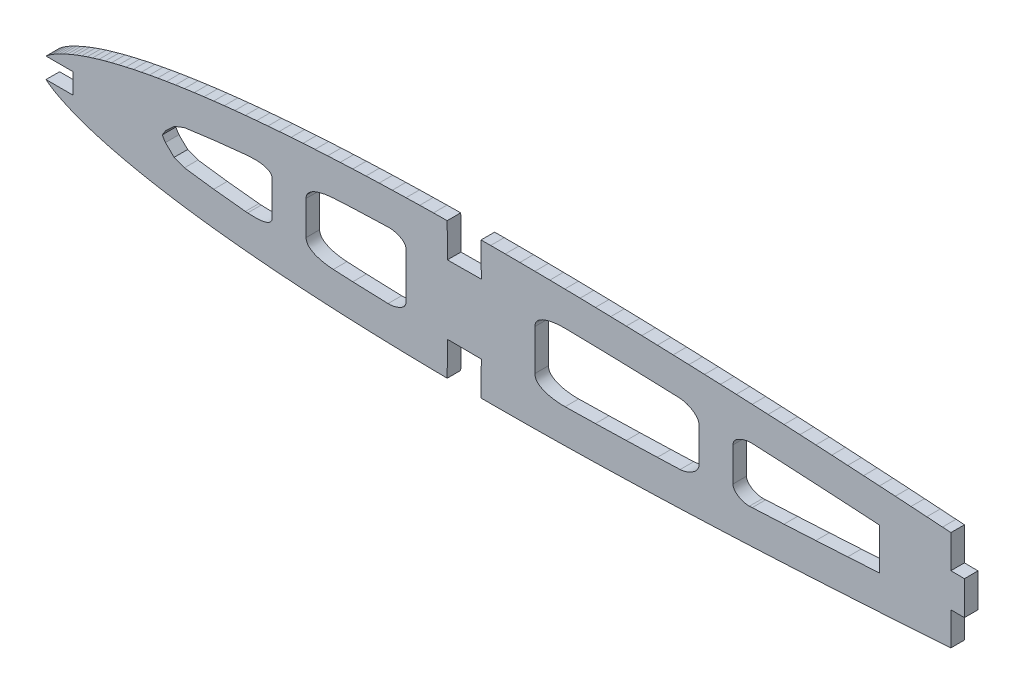
from build123d import *

# Parameters (mm, degrees)
EXTRUDE_1_DEPTH = 2


with BuildPart() as part:
    # Model → 凸台-拉伸1 (new body)
    with BuildSketch(Plane.XY):
        Polygon((21.686734091, -120.90973406), (21.457327195, -121.09873406), (25.449734091, -121.09873406), (25.449734091, -124.09873406), (21.456905913, -124.09873406), (21.686734091, -124.28873406), (22.056734091, -124.55873406), (22.439734091, -124.80873406), (22.941734091, -125.10373406), (23.455734091, -125.37573406), (23.977734091, -125.63073406), (24.626734091, -125.92873406), (25.282734091, -126.20973406), (25.944734091, -126.47473406), (26.734734091, -126.76873406), (27.531734091, -127.04373406), (28.334734091, -127.30173406), (29.264734091, -127.58073406), (30.198734091, -127.84273406), (31.136734091, -128.08973406), (32.200734091, -128.35373406), (33.268734091, -128.60273406), (34.339734091, -128.83773406), (35.533734091, -129.08373406), (36.730734091, -129.31373406), (37.930734091, -129.53173406), (39.249734091, -129.75673406), (40.570734091, -129.96773406), (41.893734091, -130.16673406), (43.333734091, -130.36973406), (44.773734091, -130.55973406), (46.216734091, -130.73773406), (47.770734091, -130.91573406), (49.326734091, -131.08273406), (50.882734091, -131.23773406), (52.544734091, -131.39273406), (54.206734091, -131.53673406), (55.870734091, -131.66973406), (57.633734091, -131.79873406), (59.396734091, -131.91773406), (61.161734091, -132.02673406), (63.018734091, -132.12973406), (64.876734091, -132.22373406), (66.735734091, -132.30673406), (68.679734091, -132.38473406), (70.623734091, -132.45373406), (72.569734091, -132.51373406), (74.592734091, -132.56673406), (76.615734091, -132.61073406), (78.639734091, -132.64573406), (80.670734091, -132.67273406), (80.703734091, -127.67373406), (85.703734091, -127.70573406), (85.670734091, -132.70573406), (87.083734091, -132.70873406), (89.240734091, -132.70473406), (91.399734091, -132.69373406), (93.611734091, -132.67473406), (95.822734091, -132.64773406), (98.034734091, -132.61473406), (100.292734091, -132.57373406), (102.550734091, -132.52573406), (104.807734091, -132.47073406), (107.103734091, -132.40973406), (109.397734091, -132.34273406), (111.692734091, -132.26873406), (114.015734091, -132.18873406), (116.336734091, -132.10273406), (118.658734091, -132.01073406), (121.000734091, -131.91373406), (123.341734091, -131.81073406), (125.683734091, -131.70273406), (128.033734091, -131.58973406), (130.382734091, -131.47073406), (132.732734091, -131.34573406), (135.082734091, -131.21573406), (137.431734091, -131.08173406), (139.781734091, -130.94373406), (142.123734091, -130.80473406), (144.464734091, -130.66373406), (146.806734091, -130.51773406), (149.128734091, -130.36773406), (151.450734091, -130.21273406), (153.772734091, -130.05473406), (155.015715913, -129.96861898), (155.015715913, -125.09813493), (157.015715913, -125.09813493), (157.015715913, -122.59813493), (157.015715913, -120.117743076), (155.015812036, -120.09813493), (155.015812036, -115.2298558), (153.772734091, -115.14373406), (151.450734091, -114.98573406), (149.128734091, -114.83073406), (146.806734091, -114.68073406), (144.464734091, -114.53473406), (142.123734091, -114.39273406), (139.781734091, -114.25473406), (137.431734091, -114.11673406), (135.082734091, -113.98273406), (132.732734091, -113.85273406), (130.382734091, -113.72773406), (128.033734091, -113.60873406), (125.683734091, -113.49573406), (123.341734091, -113.38773406), (121.000734091, -113.28473406), (118.658734091, -113.18773406), (116.336734091, -113.09573406), (114.015734091, -113.00973406), (111.692734091, -112.92973406), (109.397734091, -112.85573406), (107.103734091, -112.78873406), (104.807734091, -112.72773406), (102.550734091, -112.67273406), (100.292734091, -112.62473406), (98.034734091, -112.58373406), (95.822734091, -112.54973406), (93.611734091, -112.52373406), (91.399734091, -112.50473406), (89.240734091, -112.49373406), (87.083734091, -112.48973406), (85.670734091, -112.49273406), (85.705734091, -117.49273406), (80.705734091, -117.52473406), (80.670739865, -112.525558807), (78.639734091, -112.55173406), (76.615734091, -112.58773406), (74.592734091, -112.63173406), (72.569734091, -112.68473406), (70.623734091, -112.74473406), (68.679734091, -112.81273406), (66.735734091, -112.89073406), (64.876734091, -112.97473406), (63.018734091, -113.06873406), (61.161734091, -113.17173406), (59.396734091, -113.28073406), (57.633734091, -113.39873406), (55.870734091, -113.52873406), (54.206734091, -113.66173406), (52.544734091, -113.80573406), (50.882734091, -113.95973406), (49.326734091, -114.11573406), (47.770734091, -114.28173406), (46.216734091, -114.46073406), (44.773734091, -114.63873406), (43.333734091, -114.82873406), (41.893734091, -115.03173406), (40.570734091, -115.23073406), (39.249734091, -115.44173406), (37.930734091, -115.66673406), (36.730734091, -115.88473406), (35.533734091, -116.11473406), (34.339734091, -116.36073406), (33.268734091, -116.59573406), (32.200734091, -116.84473406), (31.136734091, -117.10873406), (30.198734091, -117.35573406), (29.264734091, -117.61773406), (28.334734091, -117.89673406), (27.531734091, -118.15473406), (26.734734091, -118.42873406), (25.944734091, -118.72273406), (25.282734091, -118.98873406), (24.626734091, -119.26973406), (23.977734091, -119.56773406), (23.455734091, -119.82273406), (22.941734091, -120.09473406), (22.439734091, -120.38973406), (22.056734091, -120.63973406), align=None)
        with BuildLine():
            add(Edge.make_bspline(
                [(125.683734091, -118.49573406), (124.599970291, -118.44222625), (122.850528389, -119.013650164), (122.850528389, -120.09873406)],
                knots=[0, 0, 0, 0, 3.255251688, 3.255251688, 3.255251688, 3.255251688], degree=3))
            Line((125.683734091, -118.49573406), (130.382734091, -118.72773406))
            Line((130.382734091, -118.72773406), (135.082734091, -118.98273406))
            Line((135.082734091, -118.98273406), (139.781734091, -119.25473406))
            Line((139.781734091, -119.25473406), (144.464734091, -119.53473406))
            Line((144.464734091, -119.53473406), (144.464734091, -125.66273406))
            Line((144.464734091, -125.66273406), (139.781734091, -125.94273406))
            Line((139.781734091, -125.94273406), (135.082734091, -126.21473406))
            Line((135.082734091, -126.21473406), (130.382734091, -126.46973406))
            Line((130.382734091, -126.46973406), (125.683734091, -126.70173406))
            Line((125.683734091, -126.70173406), (125.277682483, -126.72002936))
            add(Edge.make_bspline(
                [(122.850528389, -125.09873406), (122.850528389, -126.071683496), (124.305719136, -126.763822712), (125.277682483, -126.72002936)],
                knots=[0, 0, 0, 0, 2.918848307, 2.918848307, 2.918848307, 2.918848307], degree=3))
            Line((122.850528389, -125.09873406), (122.850528389, -120.09873406))
        make_face(mode=Mode.SUBTRACT)
        with BuildLine():
            Line((40.372806364, -120.616513555), (41.893734091, -120.03173406))
            Line((41.893734091, -120.03173406), (46.216734091, -119.46073406))
            Line((46.216734091, -119.46073406), (50.882734091, -118.95973406))
            Line((50.882734091, -118.95973406), (51.358530456, -118.918621744))
            add(Edge.make_bspline(
                [(51.358530456, -118.918621744), (52.581056879, -118.812986442), (54.845492165, -118.87165229), (54.845492165, -120.09873406)],
                knots=[0, 0, 0, 0, 3.68124531, 3.68124531, 3.68124531, 3.68124531], degree=3))
            Line((54.845492165, -120.09873406), (54.845492165, -125.09873406))
            add(Edge.make_bspline(
                [(51.215506571, -126.266488057), (52.48185245, -126.375909684), (54.845492165, -126.369798566), (54.845492165, -125.09873406)],
                knots=[0, 0, 0, 0, 3.813193518, 3.813193518, 3.813193518, 3.813193518], degree=3))
            Line((51.215506571, -126.266488057), (50.882734091, -126.23773406))
            Line((50.882734091, -126.23773406), (46.216734091, -125.73673406))
            Line((46.216734091, -125.73673406), (41.893734091, -125.16573406))
            Line((41.893734091, -125.16573406), (40.372806364, -124.580954565))
            Line((40.372806364, -124.580954565), (39.083615037, -123.34527798))
            Line((39.083615037, -123.34527798), (38.614255702, -122.59873406))
            Line((38.614255702, -122.59873406), (39.083615037, -121.85219014))
            Line((39.083615037, -121.85219014), (40.372806364, -120.616513555))
        make_face(mode=Mode.SUBTRACT)
        with BuildLine():
            add(Edge.make_bspline(
                [(63.941669072, -118.031590226), (62.414202655, -118.108593826), (59.845492165, -118.569327898), (59.845492165, -120.09873406)],
                knots=[0, 0, 0, 0, 4.588218487, 4.588218487, 4.588218487, 4.588218487], degree=3))
            Line((63.941669072, -118.031590226), (64.33931484, -118.011543857))
            Line((64.33931484, -118.011543857), (66.735734091, -117.89073406))
            Line((66.735734091, -117.89073406), (71.980504596, -117.705539901))
            add(Edge.make_bspline(
                [(71.980504596, -117.705539901), (72.983361277, -117.670128781), (74.592734091, -118.198399194), (74.592734091, -119.201880868)],
                knots=[0, 0, 0, 0, 3.010445021, 3.010445021, 3.010445021, 3.010445021], degree=3))
            Line((74.592734091, -119.201880868), (74.592734091, -124.309067986))
            Line((74.592734091, -124.309067986), (74.592734091, -125.99563406))
            add(Edge.make_bspline(
                [(71.942427898, -127.490583721), (72.956082865, -127.526376132), (74.592734091, -127.00992075), (74.592734091, -125.99563406)],
                knots=[0, 0, 0, 0, 3.042860071, 3.042860071, 3.042860071, 3.042860071], degree=3))
            Line((71.942427898, -127.490583721), (66.735734091, -127.30673406))
            Line((66.735734091, -127.30673406), (63.866106275, -127.162068575))
            add(Edge.make_bspline(
                [(59.845492165, -125.09873406), (59.845492165, -126.605116303), (62.361634577, -127.086224199), (63.866106275, -127.162068575)],
                knots=[0, 0, 0, 0, 4.519146728, 4.519146728, 4.519146728, 4.519146728], degree=3))
            Line((59.845492165, -125.09873406), (59.845492165, -120.09873406))
        make_face(mode=Mode.SUBTRACT)
        with BuildLine():
            add(Edge.make_bspline(
                [(98.034734091, -117.58373406), (96.41535795, -117.551819871), (93.611734091, -117.975920563), (93.611734091, -119.595611152)],
                knots=[0, 0, 0, 0, 4.859071767, 4.859071767, 4.859071767, 4.859071767], degree=3))
            Line((98.034734091, -117.58373406), (101.176323663, -117.645647584))
            Line((101.176323663, -117.645647584), (103.871414129, -117.706381959))
            Line((103.871414129, -117.706381959), (107.103734091, -117.78873406))
            Line((107.103734091, -117.78873406), (111.692734091, -117.92973406))
            Line((111.692734091, -117.92973406), (114.988595775, -118.047544792))
            add(Edge.make_bspline(
                [(114.988595775, -118.047544792), (116.16154149, -118.089471792), (117.850528389, -118.925039244), (117.850528389, -120.09873406)],
                knots=[0, 0, 0, 0, 3.52108445, 3.52108445, 3.52108445, 3.52108445], degree=3))
            Line((117.850528389, -120.09873406), (117.850528389, -125.09873406))
            add(Edge.make_bspline(
                [(115.053477267, -127.147604136), (116.208467568, -127.106318953), (117.850528389, -126.254461997), (117.850528389, -125.09873406)],
                knots=[0, 0, 0, 0, 3.46718381, 3.46718381, 3.46718381, 3.46718381], degree=3))
            Line((115.053477267, -127.147604136), (111.692734091, -127.26773406))
            Line((111.692734091, -127.26773406), (107.103734091, -127.40873406))
            Line((107.103734091, -127.40873406), (102.550734091, -127.52473406))
            Line((102.550734091, -127.52473406), (98.070159688, -127.613035903))
            add(Edge.make_bspline(
                [(93.611734091, -125.60183406), (93.611734091, -127.232188202), (96.440122063, -127.645160205), (98.070159688, -127.613035903)],
                knots=[0, 0, 0, 0, 4.891062426, 4.891062426, 4.891062426, 4.891062426], degree=3))
            Line((93.611734091, -125.60183406), (93.611734091, -119.595611152))
        make_face(mode=Mode.SUBTRACT)
    extrude(amount=EXTRUDE_1_DEPTH)


solid = part.part
